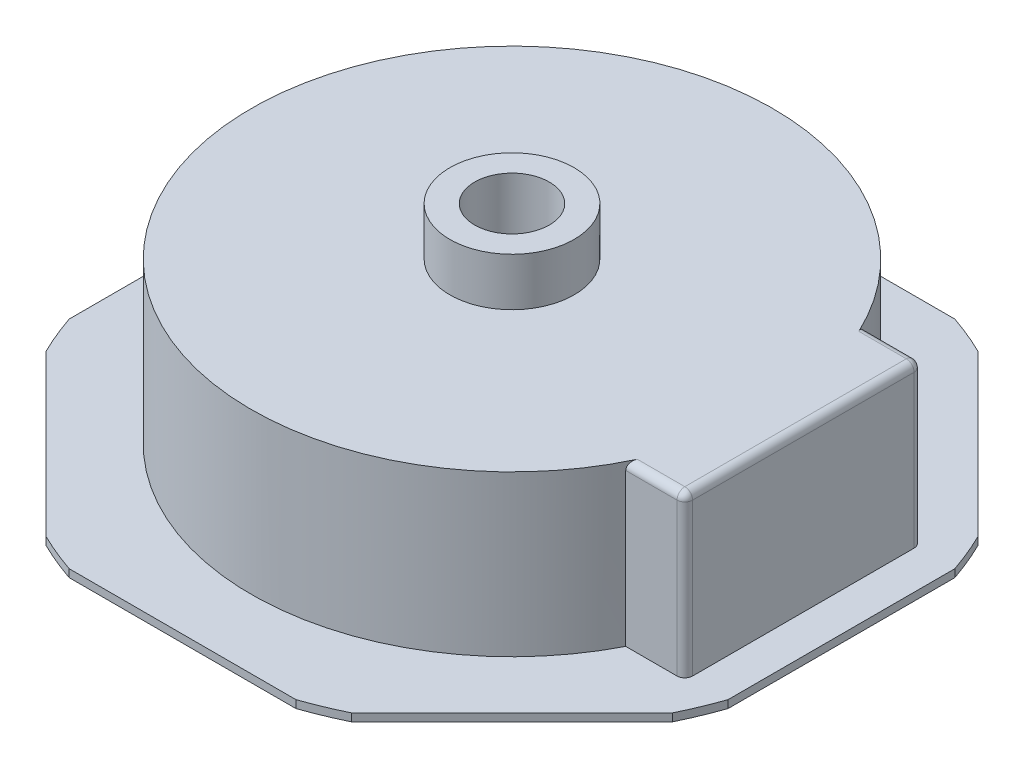
from build123d import *

# Parameters (mm, degrees)
EXTRUDE_1_DEPTH          = 10
SKETCH_2_R               = 335.5
EXTRUDE_2_DEPTH          = 206
EXTRUDE_3_REACH          = 639.278
SHELL_1_T                = -5
SKETCH_4_R               = 80
EXTRUDE_4_DEPTH          = 61.8
EXTRUDE_START            = 128.6
SKETCH_5_R               = 80
EXTRUDE_5_DEPTH          = 128.6
SKETCH_7_R               = 48
CUT_EXTRUDE_1_DEPTH      = 661.787443131
RIB_START                = -5
RIB_2_DEPTH              = 10
PATTERN_CIRCULAR_2_COUNT = 6
RIB_9_REACH              = 662.787
SKETCH_13_WALL_W         = 1624.932905634
SKETCH_13_WALL_H         = 10
FILLET_1_R               = 10
FILLET_2_R               = 10
FILLET_3_R               = 10


# Read off the part's stored shape, not the designer's step: 筋2
with BuildPart() as part:
    # 草图1 → 凸台-拉伸1 (new body)
    with BuildSketch(Plane(origin=(0, 0, 0), x_dir=(1, 0, 0), z_dir=(0, 1, 0))):
        with BuildLine():
            ThreePointArc((145.890781066, -423.95), (171.576116901, -414.221388401), (196.61755928, -402.938280488))
            Line((196.61755928, -402.938280488), (402.938280488, -196.61755928))
            ThreePointArc((402.938280488, -196.61755928), (414.221388401, -171.576116901), (423.95, -145.890781066))
            Line((423.95, -145.890781066), (423.95, 145.890781066))
            ThreePointArc((423.95, 145.890781066), (414.221388401, 171.576116901), (402.938280488, 196.61755928))
            Line((402.938280488, 196.61755928), (196.61755928, 402.938280488))
            ThreePointArc((196.61755928, 402.938280488), (171.576116901, 414.221388401), (145.890781066, 423.95))
            Line((145.890781066, 423.95), (-145.890781066, 423.95))
            ThreePointArc((-145.890781066, 423.95), (-171.576116901, 414.221388401), (-196.61755928, 402.938280488))
            Line((-196.61755928, 402.938280488), (-402.938280488, 196.61755928))
            ThreePointArc((-402.938280488, 196.61755928), (-414.221388401, 171.576116901), (-423.95, 145.890781066))
            Line((-423.95, 145.890781066), (-423.95, -145.890781066))
            ThreePointArc((-423.95, -145.890781066), (-414.221388401, -171.576116901), (-402.938280488, -196.61755928))
            Line((-402.938280488, -196.61755928), (-196.61755928, -402.938280488))
            ThreePointArc((-196.61755928, -402.938280488), (-171.576116901, -414.221388401), (-145.890781066, -423.95))
            Line((-145.890781066, -423.95), (145.890781066, -423.95))
        make_face()
    extrude(amount=EXTRUDE_1_DEPTH)

    # 草图2 → 凸台-拉伸2 (add)
    with BuildSketch(Plane(origin=(0, 10, 0), x_dir=(1, 0, 0), z_dir=(0, 1, 0))):
        with Locations(Location((0, 0, 0), (0, 0, 270))):
            Circle(SKETCH_2_R)
    extrude(amount=EXTRUDE_2_DEPTH)

    # 草图3 → 凸台-拉伸3 (add, up to next)
    with BuildSketch(Plane(origin=(0, 216, 0), x_dir=(1, 0, 0), z_dir=(0, 1, 0)), mode=Mode.PRIVATE) as extrude_3_sk1:
        with BuildLine():
            ThreePointArc((298.83774862, 152.5), (326.205697882, 78.422526541), (335.5, 0))
            Line((335.5, 0), (374.873930941, 0))
            Line((374.873930941, 0), (374.873930941, 152.5))
            Line((374.873930941, 152.5), (298.83774862, 152.5))
        make_face()
    extrude_3_tool1 = extrude(extrude_3_sk1.sketch, amount=-EXTRUDE_3_REACH, mode=Mode.PRIVATE) - part.part
    # 草图3 → 凸台-拉伸3 (add, up to next)
    with BuildSketch(Plane(origin=(0, 216, 0), x_dir=(1, 0, 0), z_dir=(0, 1, 0)), mode=Mode.PRIVATE) as extrude_3_sk2:
        with BuildLine():
            Line((374.873930941, 0), (335.5, 0))
            ThreePointArc((335.5, 0), (326.205697882, -78.422526541), (298.83774862, -152.5))
            Line((298.83774862, -152.5), (374.873930941, -152.5))
            Line((374.873930941, -152.5), (374.873930941, 0))
        make_face()
    extrude_3_tool2 = extrude(extrude_3_sk2.sketch, amount=-EXTRUDE_3_REACH, mode=Mode.PRIVATE) - part.part
    add(extrude_3_tool1.solids().sort_by_distance((348.072526, 216, -85.221274))[0])
    add(extrude_3_tool2.solids().sort_by_distance((348.072526, 216, 85.221274))[0])

    # 抽壳1
    shell_1_openings = [part.faces().sort_by_distance(p)[0] for p in [
        (0, 0, 0),
    ]]
    offset(amount=SHELL_1_T, openings=shell_1_openings, kind=Kind.INTERSECTION)

    # 草图4 → 凸台-拉伸4 (add)
    with BuildSketch(Plane(origin=(0, 216, 0), x_dir=(1, 0, 0), z_dir=(0, 1, 0))):
        with Locations(Location((0, 0, 0), (0, 0, 90))):
            Circle(SKETCH_4_R)
    extrude(amount=EXTRUDE_4_DEPTH)

    # 草图5 → 凸台-拉伸5 (add)
    with BuildSketch(Plane.XZ.offset(-211).offset(EXTRUDE_START)):
        with Locations(Location((0, 0, 0), (0, 0, 270))):
            Circle(SKETCH_5_R)
    extrude(amount=-EXTRUDE_5_DEPTH)

    # 草图7 → 切除-拉伸1 (cut, through all)
    with BuildSketch(Plane(origin=(0, 277.8, 0), x_dir=(1, 0, 0), z_dir=(0, 1, 0))):
        with Locations(Location((0, 0, 0), (0, 0, 270))):
            Circle(SKETCH_7_R)
    extrude(amount=-CUT_EXTRUDE_1_DEPTH, mode=Mode.SUBTRACT)

    # 筋2 outline → 筋2 (add)
    with BuildSketch(Plane.XY.offset(RIB_START)):
        Polygon((-330.5, 109.315910213), (-79.843597113, 87.38631652), (-78, 87.225022673), (-78, 211), (-332, 211), (-332, 109.447143208), align=None)
    rib_2 = extrude(amount=RIB_2_DEPTH)

    # 阵列(圆周)2: 筋2 ×6 about axis, 1 skipped
    pattern_circular_2_axis = Axis((0, 0, 0), (0, 1, 0))
    add([rib_2.rotate(pattern_circular_2_axis, i * 360 / PATTERN_CIRCULAR_2_COUNT) for i in range(1, PATTERN_CIRCULAR_2_COUNT) if i not in (3,)])

    # 草图13 wall → 筋9 (add, up to next)
    with BuildSketch(Plane(origin=(224.936965471, 128.6, 0), x_dir=(0.961892208962, 0.2734289274, 0), z_dir=(-0.2734289274, 0.961892208962, 0)), mode=Mode.PRIVATE) as rib_9_sk1:
        Rectangle(SKETCH_13_WALL_W, SKETCH_13_WALL_H)
    rib_9_tool1 = extrude(rib_9_sk1.sketch, amount=RIB_9_REACH, mode=Mode.PRIVATE) - part.part
    add(rib_9_tool1.solids().sort_by_distance((224.936965471, 128.6, 0))[0])

    # 圆角1
    fillet_1_edges = [part.edges().sort_by_distance(p)[0] for p in [
        (374.873930941, 113, -152.5),
        (336.85583978, 216, -152.5),
    ]]
    fillet(fillet_1_edges, radius=FILLET_1_R)

    # 圆角2
    # the kernel refuses this fillet: 10 mm, written as the material it adds along each edge
    with BuildSketch(Plane(origin=(369.873930941, 211, -5), x_dir=(-1, 0, 0), z_dir=(0, 0, -1))) as fillet_2_piece_1:
        with BuildLine():
            CenterArc((FILLET_2_R, -FILLET_2_R), FILLET_2_R, 90, 90)
            Line((0, -FILLET_2_R), (0, 0))
            Line((0, 0), (FILLET_2_R, 0))
        make_face()
    extrude(amount=142.5)
    # the kernel refuses this fillet: 10 mm, written as the material it takes off along each edge
    with BuildSketch(Plane(origin=(364.873930941, 206, -142.5), x_dir=(0, 1, 0), z_dir=(1, 0, 0))) as fillet_2_2_piece_1_section:
        Polygon((0, 0), (FILLET_2_R * 1.02, 0), (FILLET_2_R * 1.02, -FILLET_2_R * 1.02), (0, -FILLET_2_R * 1.02), align=None)
    fillet_2_2_piece_1 = extrude(amount=FILLET_2_R * 1.02, mode=Mode.PRIVATE)
    fillet_2_2_piece_1 = fillet_2_2_piece_1 - Plane(origin=(364.873930941, 206, -142.5), x_dir=(0, -0.7071067811865475, 0.7071067811865475), z_dir=(1, 0, 0)) * Sphere(FILLET_2_R, mode=Mode.PRIVATE)
    add(fillet_2_2_piece_1, mode=Mode.SUBTRACT)
    with BuildSketch(Plane(origin=(374.873930941, 216, -142.5), x_dir=(0, -1, 0), z_dir=(0, 0, 1))) as fillet_2_2_piece_2:
        with BuildLine():
            CenterArc((FILLET_2_R, -FILLET_2_R), FILLET_2_R, 90, 90)
            Line((0, -FILLET_2_R), (0, 0))
            Line((0, 0), (FILLET_2_R, 0))
        make_face()
    extrude(amount=320, mode=Mode.SUBTRACT)

    # 圆角3
    fillet_3_edges = [part.edges().sort_by_distance(p)[0] for p in [
        (331.85583978, 216, 152.5),
        (371.944998753, 213.071067812, 152.5),
        (374.873930941, 108, 152.5),
    ]]
    fillet(fillet_3_edges, radius=FILLET_3_R)


solid = part.part
